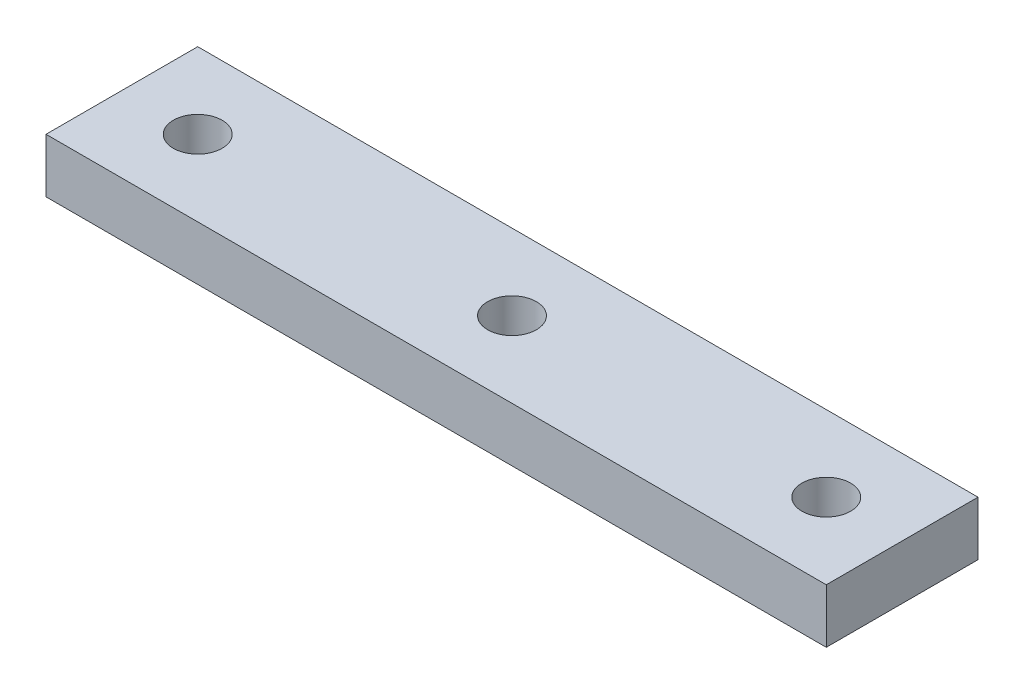
from build123d import *

# Parameters (mm, degrees)
SKETCH1_W           = 72
SKETCH1_H           = 14
SKETCH1_R           = 2.25
BOSS_EXTRUDE1_DEPTH = 5


with BuildPart() as part:
    # Sketch1 → Boss-Extrude1 (new body)
    with BuildSketch(Plane(origin=(0, 0, 0), x_dir=(1, 0, 0), z_dir=(0, 1, 0))):
        Rectangle(SKETCH1_W, SKETCH1_H)
        Circle(SKETCH1_R, mode=Mode.SUBTRACT)
        with Locations((29, 0)):
            Circle(SKETCH1_R, mode=Mode.SUBTRACT)
        with Locations((-29, 0)):
            Circle(SKETCH1_R, mode=Mode.SUBTRACT)
    extrude(amount=BOSS_EXTRUDE1_DEPTH)


solid = part.part
